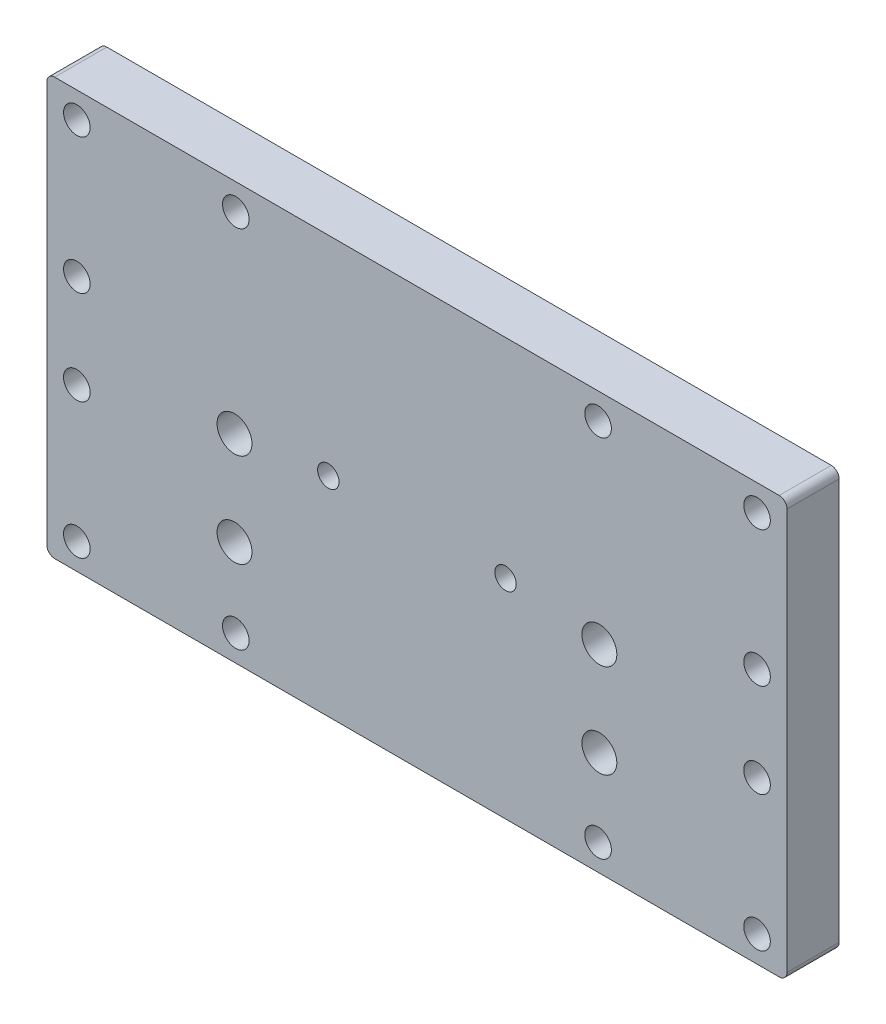
from build123d import *

# Parameters (mm, degrees)
SKETCH1_W           = 142
SKETCH1_H           = 80
BOSS_EXTRUDE1_DEPTH = 5
SKETCH2_R           = 2.55
CUT_EXTRUDE1_DEPTH  = 83.1035931
SKETCH3_R           = 2.05
CUT_EXTRUDE2_DEPTH  = 83.1035931
SKETCH4_R           = 3.35
CUT_EXTRUDE3_DEPTH  = 83.1035931
FILLET1_R           = 1.5


with BuildPart() as part:
    # Sketch1 → Boss-Extrude1 (new, symmetric)
    with BuildSketch(Plane.XY):
        Rectangle(SKETCH1_W, SKETCH1_H)
    extrude(amount=BOSS_EXTRUDE1_DEPTH, both=True)

    # Sketch2 → Cut-Extrude1 (cut, through all)
    with BuildSketch(Plane.XY.offset(5)):
        with Locations((-65.25, 35)):
            Circle(SKETCH2_R)
        with Locations((-34.75, 35)):
            Circle(SKETCH2_R)
        with Locations((-65.25, 9)):
            Circle(SKETCH2_R)
        with Locations((65.25, 35)):
            Circle(SKETCH2_R)
        with Locations((65.25, 9)):
            Circle(SKETCH2_R)
        with Locations((34.75, 35)):
            Circle(SKETCH2_R)
        with Locations((-65.25, -9)):
            Circle(SKETCH2_R)
        with Locations((-34.75, -35)):
            Circle(SKETCH2_R)
        with Locations((-65.25, -35)):
            Circle(SKETCH2_R)
        with Locations((65.25, -9)):
            Circle(SKETCH2_R)
        with Locations((65.25, -35)):
            Circle(SKETCH2_R)
        with Locations((34.75, -35)):
            Circle(SKETCH2_R)
    extrude(amount=-CUT_EXTRUDE1_DEPTH, mode=Mode.SUBTRACT)

    # Sketch3 → Cut-Extrude2 (cut, through all)
    with BuildSketch(Plane.XY.offset(5)):
        with Locations((-17, 0)):
            Circle(SKETCH3_R)
        with Locations((17, 0)):
            Circle(SKETCH3_R)
    extrude(amount=-CUT_EXTRUDE2_DEPTH, mode=Mode.SUBTRACT)

    # Sketch4 → Cut-Extrude3 (cut, through all)
    with BuildSketch(Plane.XY.offset(5)):
        with Locations((-35, -2)):
            Circle(SKETCH4_R)
        with Locations((35, -2)):
            Circle(SKETCH4_R)
        with Locations((35, -20)):
            Circle(SKETCH4_R)
        with Locations((-35, -20)):
            Circle(SKETCH4_R)
    extrude(amount=-CUT_EXTRUDE3_DEPTH, mode=Mode.SUBTRACT)

    # Fillet1
    fillet1_edges = [part.edges().sort_by_distance(p)[0] for p in [
        (-71, -40, 0),
        (71, -40, 0),
        (71, 40, 0),
        (-71, 40, 0),
    ]]
    fillet(fillet1_edges, radius=FILLET1_R)


solid = part.part
